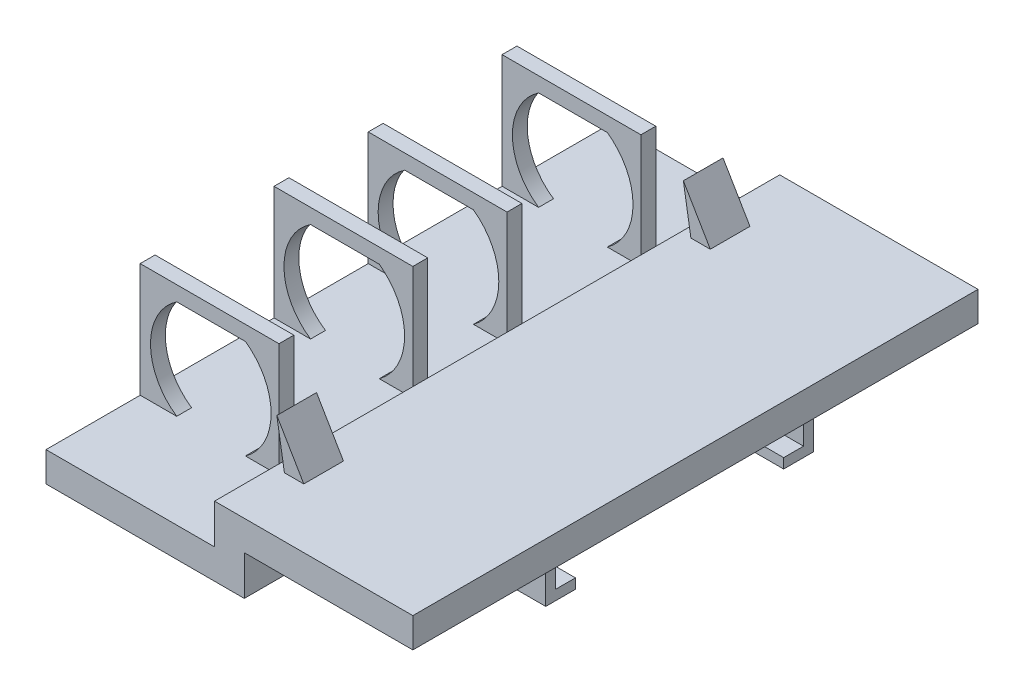
from build123d import *

# Parameters (mm, degrees)
AUFSATZ_LINEAR_AUSTRAGEN1_DEPTH = 57
SKIZZE4_W                       = 14
SKIZZE4_H                       = 1.5
AUFSATZ_LINEAR_AUSTRAGEN2_DEPTH = 11.5
SCHNITT_LINEAR_AUSTRAGEN1_DEPTH = 11.5
SKIZZE8_W                       = 14
SKIZZE8_H                       = 11.5
AUFSATZ_LINEAR_AUSTRAGEN3_DEPTH = 1.5
SCHNITT_LINEAR_AUSTRAGEN5_DEPTH = 1.5
SKIZZE10_W                      = 4
SKIZZE10_H                      = 3
AUFSATZ_LINEAR_AUSTRAGEN4_DEPTH = 4.5
SKIZZE11_W                      = 2
SKIZZE11_H                      = 3.5
SCHNITT_LINEAR_AUSTRAGEN6_DEPTH = 4
SPIEGELN7_COPY_1_SKETCH_W       = 4
SPIEGELN7_COPY_1_SKETCH_H       = 3
SPIEGELN7_COPY_1_DEPTH          = 4.5
SPIEGELN7_COPY_2_SKETCH_W       = 2
SPIEGELN7_COPY_2_SKETCH_H       = 3.5
SPIEGELN7_COPY_2_DEPTH          = 4
SPIEGELN7_COPY_3_SKETCH_W       = 4
SPIEGELN7_COPY_3_SKETCH_H       = 3
SPIEGELN7_COPY_3_DEPTH          = 4.5
SPIEGELN7_COPY_4_SKETCH_W       = 2
SPIEGELN7_COPY_4_SKETCH_H       = 3.5
SPIEGELN7_COPY_4_DEPTH          = 4
AUFSATZ_LINEAR_AUSTRAGEN6_DEPTH = 4


with BuildPart() as part:
    # Skizze1 → Aufsatz-Linear austragen1 (new body)
    with BuildSketch(Plane.XY):
        Polygon((-20, 0), (0, 0), (0, 4), (17, 4), (17, 7), (-3, 7), (-3, 3), (-20, 3), align=None)
    extrude(amount=AUFSATZ_LINEAR_AUSTRAGEN1_DEPTH)

    # Skizze4 → Aufsatz-Linear austragen2 (add)
    with BuildSketch(Plane(origin=(0, 3, 0), x_dir=(1, 0, 0), z_dir=(0, 1, 0))):
        with Locations((-13, -33.25)):
            Rectangle(SKIZZE4_W, SKIZZE4_H)
    aufsatz_linear_austragen2 = extrude(amount=AUFSATZ_LINEAR_AUSTRAGEN2_DEPTH)

    # Skizze7 → Schnitt-Linear austragen1 (cut)
    with BuildSketch(Plane.XY.offset(34)):
        with BuildLine():
            Line((-9.38702331, 3), (-16.31662479, 3))
            ThreePointArc((-16.31662479, 3), (-19, 8), (-16.31662479, 13))
            Line((-16.31662479, 13), (-9.38702331, 13))
            ThreePointArc((-9.38702331, 13), (-6.831239949, 8), (-9.38702331, 3))
        make_face()
    schnitt_linear_austragen1 = extrude(amount=-SCHNITT_LINEAR_AUSTRAGEN1_DEPTH, mode=Mode.SUBTRACT)

    # Spiegeln1: Aufsatz-Linear austragen2 across plane
    add(aufsatz_linear_austragen2.mirror(Plane(origin=(0, 0, 28.5), x_dir=(1, 0, 0), z_dir=(0, 0, -1))))

    # Spiegeln2: Schnitt-Linear austragen1 across plane
    add(schnitt_linear_austragen1.mirror(Plane(origin=(0, 0, 28.5), x_dir=(1, 0, 0), z_dir=(0, 0, -1))), mode=Mode.SUBTRACT)

    # Skizze8 → Aufsatz-Linear austragen3 (add)
    with BuildSketch(Plane(origin=(0, 0, 9.5), x_dir=(-1, 0, 0), z_dir=(0, 0, -1))):
        with Locations((13, 8.75)):
            Rectangle(SKIZZE8_W, SKIZZE8_H)
    aufsatz_linear_austragen3 = extrude(amount=-AUFSATZ_LINEAR_AUSTRAGEN3_DEPTH)

    # Skizze9 → Schnitt-Linear austragen5 (cut)
    with BuildSketch(Plane(origin=(0, 0, 9.5), x_dir=(-1, 0, 0), z_dir=(0, 0, -1))):
        with BuildLine():
            Line((9.38702331, 3), (16.31662479, 3))
            ThreePointArc((16.31662479, 3), (18.961352587, 8), (16.31662479, 13))
            Line((16.31662479, 13), (9.38702331, 13))
            ThreePointArc((9.38702331, 13), (6.794620892, 8), (9.38702331, 3))
        make_face()
    schnitt_linear_austragen5 = extrude(amount=-SCHNITT_LINEAR_AUSTRAGEN5_DEPTH, mode=Mode.SUBTRACT)

    # Spiegeln5: Aufsatz-Linear austragen3, Schnitt-Linear austragen5 across plane
    add(aufsatz_linear_austragen3.mirror(Plane(origin=(0, 0, 28.5), x_dir=(1, 0, 0), z_dir=(0, 0, -1))))
    add(schnitt_linear_austragen5.mirror(Plane(origin=(0, 0, 28.5), x_dir=(1, 0, 0), z_dir=(0, 0, -1))), mode=Mode.SUBTRACT)

    # Skizze10 → Aufsatz-Linear austragen4 (add)
    with BuildSketch(Plane.XZ.offset(-4)):
        with Locations((13.4, 16.5)):
            Rectangle(SKIZZE10_W, SKIZZE10_H)
    aufsatz_linear_austragen4 = extrude(amount=AUFSATZ_LINEAR_AUSTRAGEN4_DEPTH)

    # Skizze11 → Schnitt-Linear austragen6 (cut)
    with BuildSketch(Plane(origin=(15.4, 0, 0), x_dir=(0, 0, -1), z_dir=(1, 0, 0))):
        with Locations((-17, 2.25)):
            Rectangle(SKIZZE11_W, SKIZZE11_H)
    schnitt_linear_austragen6 = extrude(amount=-SCHNITT_LINEAR_AUSTRAGEN6_DEPTH, mode=Mode.SUBTRACT)

    # Spiegeln6: Aufsatz-Linear austragen4, Schnitt-Linear austragen6 across plane
    add(aufsatz_linear_austragen4.mirror(Plane(origin=(8, 0, 0), x_dir=(0, 0, 1), z_dir=(1, 0, 0))))
    add(schnitt_linear_austragen6.mirror(Plane(origin=(8, 0, 0), x_dir=(0, 0, 1), z_dir=(1, 0, 0))), mode=Mode.SUBTRACT)

    # Spiegeln7 copy 1 sketch → Spiegeln7 copy 1 (add)
    with BuildSketch(Plane(origin=(16, 4, 57), x_dir=(-1, 0, 0), z_dir=(0, -1, 0))):
        with Locations((13.4, 16.5)):
            Rectangle(SPIEGELN7_COPY_1_SKETCH_W, SPIEGELN7_COPY_1_SKETCH_H)
    extrude(amount=SPIEGELN7_COPY_1_DEPTH)

    # Spiegeln7 copy 2 sketch → Spiegeln7 copy 2 (cut)
    with BuildSketch(Plane(origin=(0.6, 0, 57), x_dir=(0, 0, 1), z_dir=(-1, 0, 0))):
        with Locations((-17, 2.25)):
            Rectangle(SPIEGELN7_COPY_2_SKETCH_W, SPIEGELN7_COPY_2_SKETCH_H)
    extrude(amount=-SPIEGELN7_COPY_2_DEPTH, mode=Mode.SUBTRACT)

    # Spiegeln7 copy 3 sketch → Spiegeln7 copy 3 (add)
    with BuildSketch(Plane(origin=(0, 4, 57), x_dir=(1, 0, 0), z_dir=(0, -1, 0))):
        with Locations((13.4, -16.5)):
            Rectangle(SPIEGELN7_COPY_3_SKETCH_W, SPIEGELN7_COPY_3_SKETCH_H)
    extrude(amount=SPIEGELN7_COPY_3_DEPTH)

    # Spiegeln7 copy 4 sketch → Spiegeln7 copy 4 (cut)
    with BuildSketch(Plane(origin=(15.4, 0, 57), x_dir=(0, 0, 1), z_dir=(1, 0, 0))):
        with Locations((-17, -2.25)):
            Rectangle(SPIEGELN7_COPY_4_SKETCH_W, SPIEGELN7_COPY_4_SKETCH_H)
    extrude(amount=-SPIEGELN7_COPY_4_DEPTH, mode=Mode.SUBTRACT)

    # Skizze15 → Aufsatz-Linear austragen6 (add)
    with BuildSketch(Plane.XY.offset(47)):
        Polygon((-0.927692944, 7), (0, 7), (-2.716370788, 11.624493937), (-1.955549721, 7), align=None)
    aufsatz_linear_austragen6 = extrude(amount=AUFSATZ_LINEAR_AUSTRAGEN6_DEPTH)

    # Spiegeln10: Aufsatz-Linear austragen6 across plane
    add(aufsatz_linear_austragen6.mirror(Plane(origin=(0, 0, 28.5), x_dir=(1, 0, 0), z_dir=(0, 0, -1))))


solid = part.part
